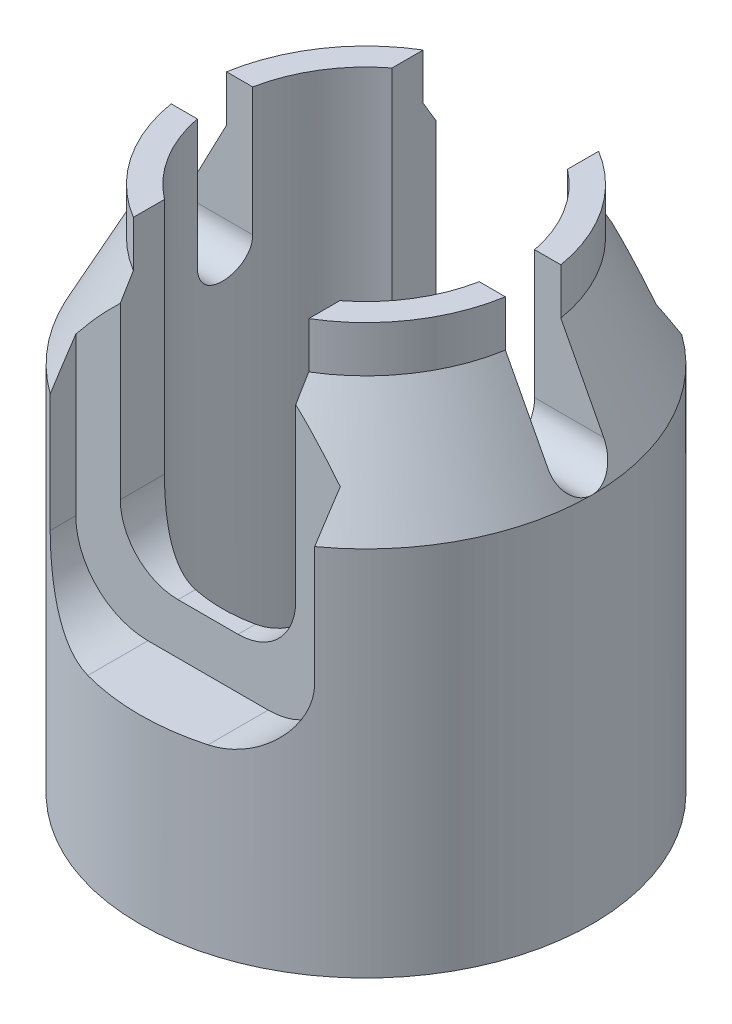
from build123d import *

# Parameters (mm, degrees)
CORTAR_EXTRUIR1_DEPTH      = 68.879789334
CORTAR_EXTRUIR1_DEPTH_BACK = 68.879789334
CORTAR_EXTRUIR2_START      = -24.8900001
CORTAR_EXTRUIR2_DEPTH      = 7.5100001
CORTAR_EXTRUIR3_START      = 17.38
CORTAR_EXTRUIR3_DEPTH      = 10
CORTAR_EXTRUIR4_DEPTH      = 68.879789407
CORTAR_EXTRUIR4_DEPTH_BACK = 68.879789407
CROQUIS4_R                 = 3.05
CORTAR_EXTRUIR6_DEPTH      = 68.879789407
CORTAR_EXTRUIR6_DEPTH_BACK = 68.879789407
CROQUIS5_R                 = 15.81


# Read off the part's stored shape, not the designer's step: Cortar-Extruir2
with BuildPart() as part:
    # Croquis1 → Revolución1 (revolve)
    with BuildSketch(Plane.XY, mode=Mode.PRIVATE) as revoluci_n1_sk:
        Polygon((0, 0), (-24.89, 0), (-24.89, 40.89), (-18.64, 52.96), (-18.64, 58.04), (0, 58.04), align=None)
    revolve(revoluci_n1_sk.sketch.rotate(Axis((0, 58.04, 0), (0, -1, 0)), 270), axis=Axis((0, 58.04, 0), (0, -1, 0)))

    # Croquis2 → Cortar-Extruir1 (cut, two sides: drawn at the far end of the back side and taken through both)
    with BuildSketch(Plane.XY.offset(-CORTAR_EXTRUIR1_DEPTH_BACK)):
        with BuildLine():
            Line((3.3, 25.5), (-3.3, 25.5))
            ThreePointArc((-3.3, 25.5), (-7.790128061, 27.359871939), (-9.65, 31.85))
            Line((-9.65, 31.85), (-9.65, 58.04))
            Line((-9.65, 58.04), (9.65, 58.04))
            Line((9.65, 58.04), (9.65, 31.85))
            ThreePointArc((9.65, 31.85), (7.790128061, 27.359871939), (3.3, 25.5))
        make_face()
    extrude(amount=CORTAR_EXTRUIR1_DEPTH + CORTAR_EXTRUIR1_DEPTH_BACK, mode=Mode.SUBTRACT)

    # Cortar-Extruir2 outline → Cortar-Extruir2 (cut)
    with BuildSketch(Plane.XY.offset(CORTAR_EXTRUIR2_START)):
        with BuildLine():
            Line((-14.55, 58.04), (-14.55, 27.87))
            ThreePointArc((-14.55, 27.87), (-12.224427843, 22.255572157), (-6.61, 19.93))
            Line((-6.61, 19.93), (6.61, 19.93))
            ThreePointArc((6.61, 19.93), (12.224427843, 22.255572157), (14.55, 27.87))
            Line((14.55, 27.87), (14.55, 58.04))
            Line((14.55, 58.04), (9.65, 58.04))
            Line((9.65, 58.04), (9.65, 31.85))
            ThreePointArc((9.65, 31.85), (7.790128061, 27.359871939), (3.3, 25.5))
            Line((3.3, 25.5), (-3.3, 25.5))
            ThreePointArc((-3.3, 25.5), (-7.790128061, 27.359871939), (-9.65, 31.85))
            Line((-9.65, 31.85), (-9.65, 58.04))
            Line((-9.65, 58.04), (-14.55, 58.04))
        make_face()
    extrude(amount=CORTAR_EXTRUIR2_DEPTH, mode=Mode.SUBTRACT)

    # Croquis3<2> → Cortar-Extruir3 (cut)
    with BuildSketch(Plane.XY.offset(CORTAR_EXTRUIR3_START)):
        with BuildLine():
            Line((-14.55, 27.87), (-14.55, 40.89))
            Line((-14.55, 40.89), (-14.55, 58.04))
            Line((-14.55, 58.04), (-9.65, 58.04))
            Line((-9.65, 58.04), (-9.65, 47.112250397))
            Line((-9.65, 47.112250397), (-9.65, 40.89))
            Line((-9.65, 40.89), (9.65, 40.89))
            Line((9.65, 40.89), (9.65, 47.112250397))
            Line((9.65, 47.112250397), (9.65, 58.04))
            Line((9.65, 58.04), (14.55, 58.04))
            Line((14.55, 58.04), (14.55, 40.89))
            Line((14.55, 40.89), (14.55, 27.87))
            ThreePointArc((14.55, 27.87), (12.224427843, 22.255572157), (6.61, 19.93))
            Line((6.61, 19.93), (-6.61, 19.93))
            ThreePointArc((-6.61, 19.93), (-12.224427843, 22.255572157), (-14.55, 27.87))
        make_face()
    extrude(amount=CORTAR_EXTRUIR3_DEPTH, mode=Mode.SUBTRACT)

    # Croquis4 → Cortar-Extruir4 (cut, two sides: drawn at the far end of the back side and taken through both)
    with BuildSketch(Plane(origin=(0, 0, 0), x_dir=(0, 0, -1), z_dir=(1, 0, 0)).offset(-CORTAR_EXTRUIR4_DEPTH_BACK)):
        with Locations((0, 43.94)):
            Circle(CROQUIS4_R)
        with BuildLine():
            Line((-3.05, 58.04), (-3.05, 43.94))
            ThreePointArc((-3.05, 43.94), (0, 46.99), (3.05, 43.94))
            Line((3.05, 43.94), (3.05, 58.04))
            Line((3.05, 58.04), (-3.05, 58.04))
        make_face()
    extrude(amount=CORTAR_EXTRUIR4_DEPTH + CORTAR_EXTRUIR4_DEPTH_BACK, mode=Mode.SUBTRACT)

    # Croquis5 → Cortar-Extruir6 (cut, two sides: drawn at the far end of the back side and taken through both)
    with BuildSketch(Plane(origin=(0, 0, 0), x_dir=(1, 0, 0), z_dir=(0, 1, 0)).offset(-CORTAR_EXTRUIR6_DEPTH_BACK)):
        with Locations(Location((0, 0, 0), (0, 0, 102.047858454))):
            Circle(CROQUIS5_R)
    extrude(amount=CORTAR_EXTRUIR6_DEPTH + CORTAR_EXTRUIR6_DEPTH_BACK, mode=Mode.SUBTRACT)


solid = part.part
